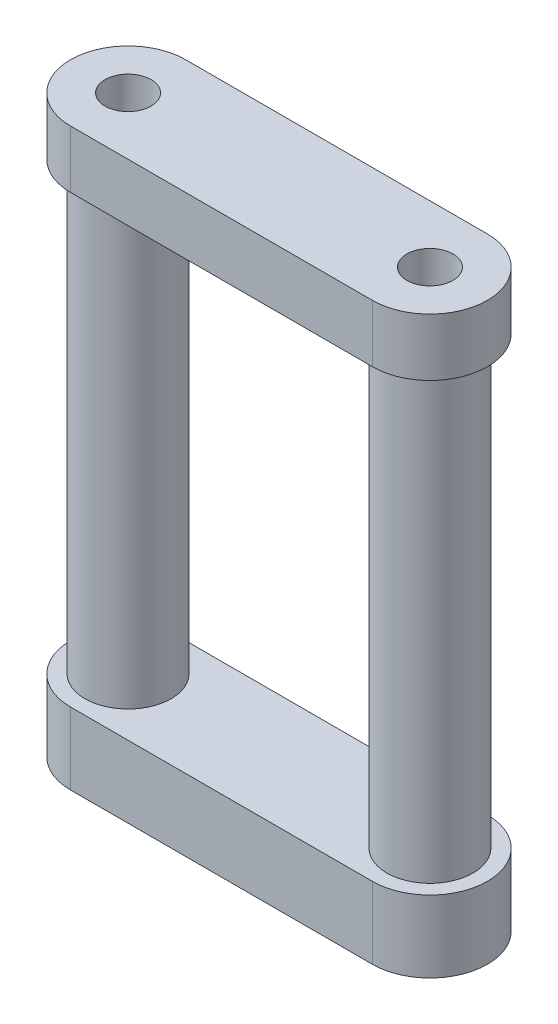
from build123d import *

# Parameters (mm, degrees)
SKETCH_1_R        = 1.5
EXTRUDE_1_DEPTH   = 5
SKETCH_2_R        = 3
SKETCH_2_R_2      = 1.6
EXTRUDE_2_DEPTH   = 31
EXTRUDE_2_2_DEPTH = 31
SKETCH_3_R        = 1.6
EXTRUDE_3_DEPTH   = 4


with BuildPart() as part:
    # ｽｹｯﾁ1 → ﾎﾞｽ - 押し出し1 (new body)
    with BuildSketch(Plane(origin=(0, 0, 0), x_dir=(1, 0, 0), z_dir=(0, 1, 0))):
        with BuildLine():
            Line((-10.5, 4), (10.5, 4))
            ThreePointArc((10.5, 4), (14.5, 0), (10.5, -4))
            Line((10.5, -4), (-10.5, -4))
            ThreePointArc((-10.5, -4), (-14.5, 0), (-10.5, 4))
        make_face()
        with Locations((-10.5, 0)):
            Circle(SKETCH_1_R, mode=Mode.SUBTRACT)
        with Locations((10.5, 0)):
            Circle(SKETCH_1_R, mode=Mode.SUBTRACT)
    extrude(amount=EXTRUDE_1_DEPTH)


with BuildPart() as body_2:
    # ｽｹｯﾁ2 → ﾎﾞｽ - 押し出し2 (new body)
    with BuildSketch(Plane(origin=(0, 5, 0), x_dir=(1, 0, 0), z_dir=(0, 1, 0))):
        with Locations((-10.5, 0)):
            Circle(SKETCH_2_R)
        with Locations((-10.5, 0)):
            Circle(SKETCH_2_R_2, mode=Mode.SUBTRACT)
    extrude(amount=EXTRUDE_2_DEPTH)


with BuildPart() as body_3:
    # ｽｹｯﾁ2 → Extrude 2 2 (new body)
    with BuildSketch(Plane(origin=(0, 5, 0), x_dir=(1, 0, 0), z_dir=(0, 1, 0))):
        with Locations((10.5, 0)):
            Circle(SKETCH_2_R)
        with Locations((10.5, 0)):
            Circle(SKETCH_2_R_2, mode=Mode.SUBTRACT)
    extrude(amount=EXTRUDE_2_2_DEPTH)


with BuildPart() as body_4:
    # ｽｹｯﾁ3 → ﾎﾞｽ - 押し出し3 (new body)
    with BuildSketch(Plane(origin=(0, 36, 0), x_dir=(1, 0, 0), z_dir=(0, 1, 0))):
        with BuildLine():
            Line((-10.5, -4), (10.5, -4))
            ThreePointArc((10.5, -4), (14.5, 0), (10.5, 4))
            Line((10.5, 4), (-10.5, 4))
            ThreePointArc((-10.5, 4), (-14.5, 0), (-10.5, -4))
        make_face()
        with Locations((10.5, 0)):
            Circle(SKETCH_3_R, mode=Mode.SUBTRACT)
        with Locations((-10.5, 0)):
            Circle(SKETCH_3_R, mode=Mode.SUBTRACT)
    extrude(amount=EXTRUDE_3_DEPTH)


solid = Compound([part.part, body_2.part, body_3.part, body_4.part])
